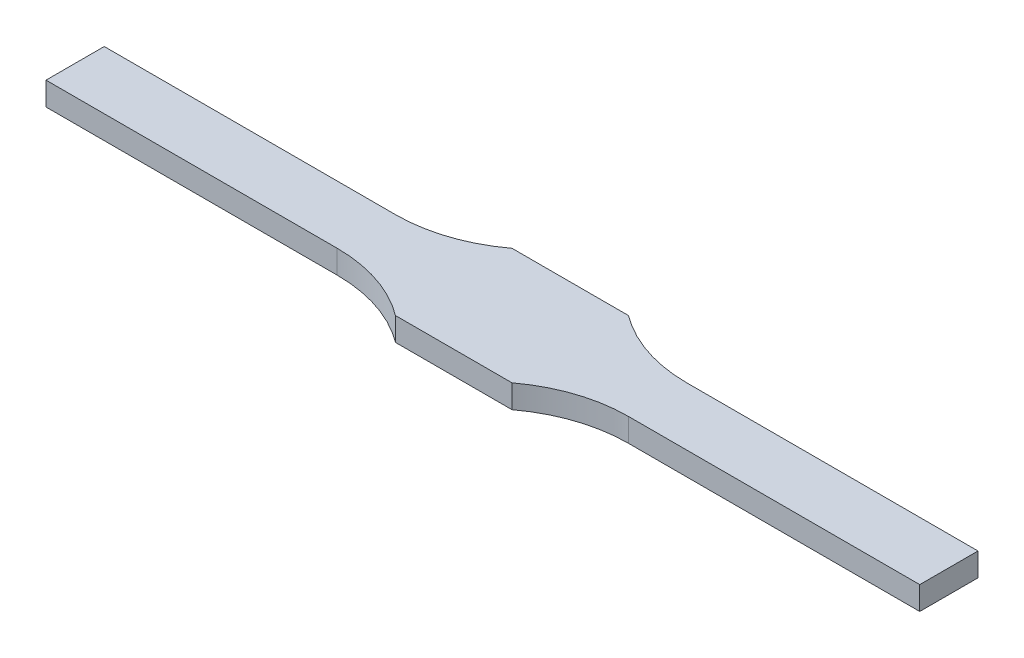
from build123d import *

# Parameters (mm, degrees)
BOSS_EXTRUDE1_DEPTH     = 2
CUT_EXTRUDE2_DEPTH      = 98.534609242
CUT_EXTRUDE2_DEPTH_BACK = 98.534609242
CIRPATTERN2_START       = -2
CIRPATTERN2_DEPTH       = 4


# Read off the part's stored shape, not the designer's step: CirPattern2
with BuildPart() as part:
    # Sketch1 → Boss-Extrude1 (new, symmetric)
    with BuildSketch(Plane(origin=(0, 0, 0), x_dir=(1, 0, 0), z_dir=(0, 1, 0))):
        with BuildLine():
            Line((25, 5), (97, 5))
            Line((97, 5), (97, -5))
            Line((97, -5), (25, -5))
            ThreePointArc((25, -5), (17.09430585, -6.282917549), (10, -10))
            Line((10, -10), (0, -10))
            Line((0, -10), (0, 10))
            Line((0, 10), (10, 10))
            ThreePointArc((10, 10), (17.09430585, 6.282917549), (25, 5))
        make_face()
    extrude(amount=BOSS_EXTRUDE1_DEPTH, both=True)

    # Sketch2<3> → Cut-Extrude2 (cut, two sides: drawn at the far end of the back side and taken through both)
    with BuildSketch(Plane(origin=(0, 0, 0), x_dir=(1, 0, 0), z_dir=(0, 1, 0)).offset(-CUT_EXTRUDE2_DEPTH_BACK)):
        Polygon((75, 5), (75, 0), (80.958767963, -5), (97, -5), (97, 5), align=None)
        Polygon((80.958767963, -5), (75, 0), (75, -5), align=None)
    extrude(amount=CUT_EXTRUDE2_DEPTH + CUT_EXTRUDE2_DEPTH_BACK, mode=Mode.SUBTRACT)

    # CirPattern2 outline → CirPattern2 (add)
    with BuildSketch(Plane(origin=(0, 0, 0), x_dir=(1, 0, 0), z_dir=(0, 1, 0)).offset(CIRPATTERN2_START)):
        with BuildLine():
            Line((0, 10), (-10, 10))
            ThreePointArc((-10, 10), (-17.09430585, 6.282917549), (-25, 5))
            Line((-25, 5), (-75, 5))
            Line((-75, 5), (-75, -5))
            Line((-75, -5), (-25, -5))
            ThreePointArc((-25, -5), (-17.09430585, -6.282917549), (-10, -10))
            Line((-10, -10), (0, -10))
            Line((0, -10), (0, 10))
        make_face()
    extrude(amount=CIRPATTERN2_DEPTH)


solid = part.part
